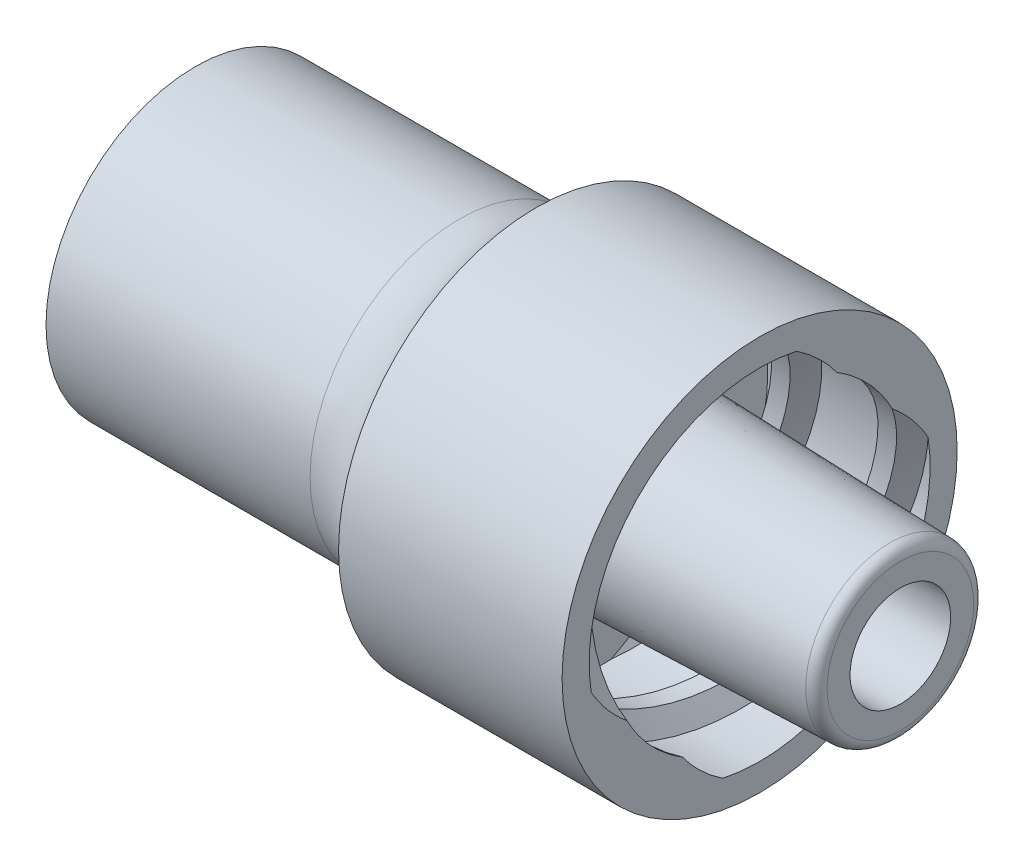
from build123d import *

# Parameters (mm, degrees)
SWEEP_LUER_PITCH      = 4.99872
CIRPATTERN_LUER_COUNT = 2
SKETCH4_W             = 5.08
SKETCH4_H             = 4.6355
BOSS_EXTRUDE1_START   = 8
SKETCH7_R             = 3.5
SKETCH7_R_2           = 1.1811
BOSS_EXTRUDE1_DEPTH   = 8
FILLET1_R             = 2


with BuildPart() as part:
    # Sketch1 → Revolve: Nozzle (revolve)
    with BuildSketch(Plane.XY, mode=Mode.PRIVATE) as revolve_nozzle_sk:
        Polygon((-8.5471, 1.1811), (-8.5471, 4.6355), (-3.302, 4.6355), (-3.302, 4.0005), (-7.112, 4.0005), (-7.112, 2.18059), (0, 1.96723), (0, 1.1811), align=None)
    revolve(revolve_nozzle_sk.sketch.rotate(Axis((-8.5471, 0, 0), (1, 0, 0)), 90), axis=Axis((-8.5471, 0, 0), (1, 0, 0)))

    # Sweep: Luer: the profile of Sketch3 profile screwed along a right-hand helix of 2.54065 turns, 12 arcs to a turn; built about Z, then put on its axis
    sweep_luer_z = Axis((0, 0, 0), (0, 0, 1))
    sweep_luer_corners = [(3.5052, 0, 0.21841314), (3.5052, 0, -0.21841314), (4.0008, 0, -0.47640617), (4.0008, 0, 0.47640617)]
    with BuildLine(mode=Mode.PRIVATE) as sweep_luer_profile:
        Line(sweep_luer_corners[0], sweep_luer_corners[1])
        Line(sweep_luer_corners[1], sweep_luer_corners[2])
        Line(sweep_luer_corners[2], sweep_luer_corners[3])
        Line(sweep_luer_corners[3], sweep_luer_corners[0])
    sweep_luer_cap = Face(sweep_luer_profile.wire())
    sweep_luer_turn_angles = [0, 15, 30, 45, 60, 75, 90, 105, 120, 135, 150, 165, 180, 195, 210, 225, 240, 255, 270, 285, 300, 315, 330, 345, 360]
    sweep_luer_turn_weights = [1, 0.9659258262890683, 1, 0.9659258262890683, 1, 0.9659258262890683, 1, 0.9659258262890683, 1, 0.9659258262890683, 1, 0.9659258262890683, 1, 0.9659258262890683, 1, 0.9659258262890683, 1, 0.9659258262890683, 1, 0.9659258262890683, 1, 0.9659258262890683, 1, 0.9659258262890683, 1]
    sweep_luer_turn_rails = [Edge.make_bspline([Vector(p[0], p[1], 0).rotate(sweep_luer_z, sweep_luer_turn_angles[k]) / sweep_luer_turn_weights[k] + Vector(0, 0, p[2] + SWEEP_LUER_PITCH * sweep_luer_turn_angles[k] / 360) for k in range(25)], [0, 0, 0, 1, 1, 2, 2, 3, 3, 4, 4, 5, 5, 6, 6, 7, 7, 8, 8, 9, 9, 10, 10, 11, 11, 12, 12, 12], 2, sweep_luer_turn_weights) for p in sweep_luer_corners]
    sweep_luer_turn_sides = [Face.make_surface_from_curves(sweep_luer_turn_rails[p[0]], sweep_luer_turn_rails[p[1]]) for p in [(0, 1), (1, 2), (2, 3), (3, 0)]]
    sweep_luer_last_angles = [720, 735, 750, 765, 780, 795, 810, 825, 840, 855, 870, 885, 900, 907.317073171, 914.634146341]
    sweep_luer_last_weights = [1, 0.9659258262890683, 1, 0.9659258262890683, 1, 0.9659258262890683, 1, 0.9659258262890683, 1, 0.9659258262890683, 1, 0.9659258262890683, 1, 0.9918565354547718, 1]
    sweep_luer_last_rails = [Edge.make_bspline([Vector(p[0], p[1], 0).rotate(sweep_luer_z, sweep_luer_last_angles[k]) / sweep_luer_last_weights[k] + Vector(0, 0, p[2] + SWEEP_LUER_PITCH * sweep_luer_last_angles[k] / 360) for k in range(15)], [0, 0, 0, 1, 1, 2, 2, 3, 3, 4, 4, 5, 5, 6, 6, 7, 7, 7], 2, sweep_luer_last_weights) for p in sweep_luer_corners]
    sweep_luer_last_sides = [Face.make_surface_from_curves(sweep_luer_last_rails[p[0]], sweep_luer_last_rails[p[1]]) for p in [(0, 1), (1, 2), (2, 3), (3, 0)]]
    sweep_luer = Plane(origin=(-0.1524, 0, 0), x_dir=(0, 1, 0), z_dir=(-1, 0, 0)) * Solid(Shell([*[p.moved(Location((0, 0, SWEEP_LUER_PITCH * i))) for i in range(2) for p in sweep_luer_turn_sides], *sweep_luer_last_sides, sweep_luer_cap, sweep_luer_cap.rotate(sweep_luer_z, 914.634146341).moved(Location((0, 0, SWEEP_LUER_PITCH * 914.634146341 / 360)))]))
    add(sweep_luer)

    # CirPattern: Luer: Sweep: Luer ×2 about axis
    cirpattern_luer_axis = Axis((-8.5471, 0, 0), (-1, 0, 0))
    for i in range(1, CIRPATTERN_LUER_COUNT):
        add(sweep_luer.rotate(cirpattern_luer_axis, i * 360 / CIRPATTERN_LUER_COUNT))

    # Sketch4 → Cut-Revolve: Luer (revolve, cut)
    with BuildSketch(Plane.XY, mode=Mode.PRIVATE) as cut_revolve_luer_sk:
        with BuildLine():
            Line((-3.302, 4.6355), (2.54, 4.6355))
            Line((2.54, 4.6355), (2.54, 0))
            Line((2.54, 0), (0, 0))
            Line((0, 0), (0, 1.720735726))
            ThreePointArc((0, 1.720735726), (-0.071721903, 1.897627487), (-0.246383427, 1.974621503))
            Line((-0.246383427, 1.974621503), (-3.302, 2.06629))
            Line((-3.302, 2.06629), (-3.302, 4.6355))
        make_face()
        with Locations((-11.0871, 2.31775)):
            Rectangle(SKETCH4_W, SKETCH4_H)
    revolve(cut_revolve_luer_sk.sketch.rotate(Axis((-15.622139093, 0, 0), (1, 0, 0)), 90), axis=Axis((-15.622139093, 0, 0), (1, 0, 0)), mode=Mode.SUBTRACT)

    # Sketch7 → Boss-Extrude1 (add)
    with BuildSketch(Plane.ZY.offset(8.5471).offset(BOSS_EXTRUDE1_START)):
        Circle(SKETCH7_R)
        Circle(SKETCH7_R_2, mode=Mode.SUBTRACT)
    extrude(amount=-BOSS_EXTRUDE1_DEPTH)

    # Fillet1
    # the kernel refuses this fillet: 2 mm, written as the material it adds along each edge
    with BuildSketch(Plane(origin=(-8.5471, 0, 0), x_dir=(0, 0, 1), z_dir=(0, -1, 0))) as fillet1_piece_1:
        with BuildLine():
            CenterArc((5.5, 1.803507624), FILLET1_R, 180, 64.389564236)
            Line((3.5, 1.803507624), (3.46, 1.803507624))
            Line((3.46, 1.803507624), (3.46, 0))
            Line((3.46, 0), (3.5, -0.04))
            ThreePointArc((3.5, -0.04), (4.06775, -0.04), (4.61821, -0.036070152))
            Line((4.61821, -0.036070152), (4.6355, 0))
        make_face()
    revolve(axis=Axis((-8.5471, 0, 0), (-1, 0, 0)))


solid = part.part
